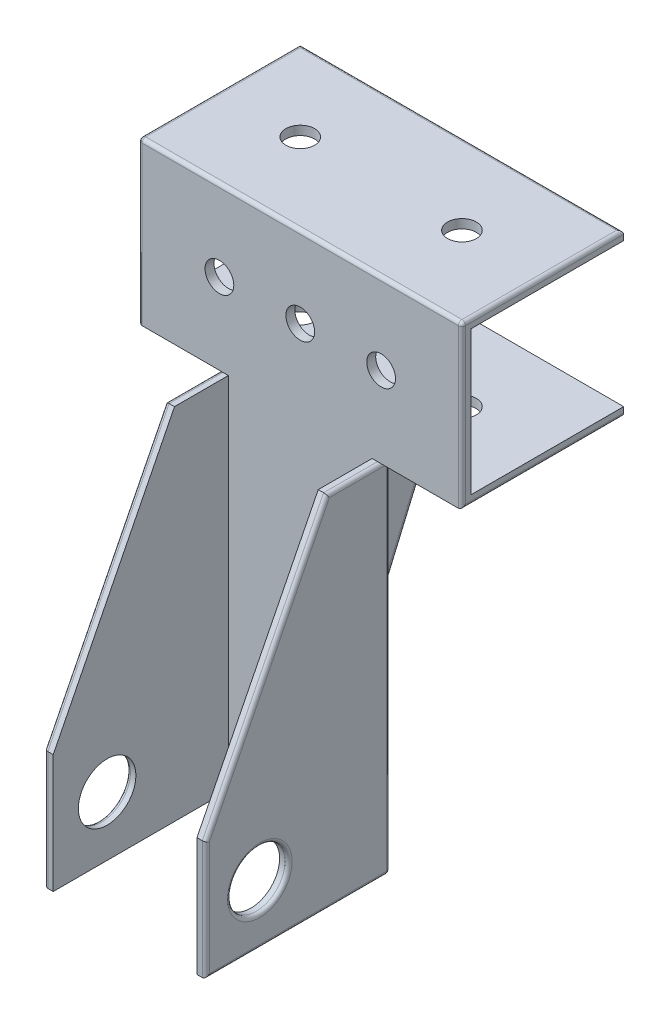
from build123d import *

# Parameters (mm, degrees)
DODANIE_WYCI_GNI_CIE1_DEPTH         = 45
DODANIE_WYCI_GNI_CIE1_DEPTH_BACK    = 45
SZKIC1_W                            = 45
SZKIC1_H                            = 45
WYTNIJ_WYCI_GNI_CIE1_DEPTH          = 96.45941546
WYTNIJ_WYCI_GNI_CIE1_DEPTH_BACK     = 96.45941546
SZKIC2_W                            = 42.5
SZKIC2_H                            = 40
DODANIE_WYCI_GNI_CIE2_DEPTH         = 70
DODANIE_WYCI_GNI_CIE2_DEPTH_BACK    = 2.5
SZKIC3_W                            = 45
SZKIC3_H                            = 100
SZKIC4_W                            = 40
SZKIC4_H                            = 70
WYTNIJ_WYCI_GNI_CIE2_DEPTH          = 144.461667354
SZKIC5_R                            = 8
WYTNIJ_WYCI_GNI_CIE4_DEPTH          = 90
ZAOKR_GLENIE2_R                     = 1
ZAOKR_GLENIE3_R                     = 1
SZKIC9_W                            = 4
SZKIC9_H                            = 45
OTWORY_USTALAJ_CE_8_0MM1_AT_2_COUNT = 2
OTWORY_USTALAJ_CE_8_0MM1_AT_2_PITCH = 22.5
OTWORY_USTALAJ_CE_8_0MM1_AT_3_COUNT = 2
OTWORY_USTALAJ_CE_8_0MM1_AT_3_PITCH = 45
SZKIC13_W                           = 4
SZKIC13_H                           = 145
OTWORY_USTALAJ_CE_8_0MM3_AT_2_COUNT = 2
OTWORY_USTALAJ_CE_8_0MM3_AT_2_PITCH = 45
DODANIE_WYCI_GNI_CIE3_DEPTH         = 1.5
DODANIE_WYCI_GNI_CIE3_DEPTH_BACK    = 1.5
ZAOKR_GLENIE4_R                     = 1.5


with BuildPart() as part:
    # Szkic1 → Dodanie-wyciągnięcie1 (new, two sides: drawn at the far end of the back side and taken through both)
    with BuildSketch(Plane(origin=(0, 0, 0), x_dir=(0, 0, -1), z_dir=(1, 0, 0)).offset(-DODANIE_WYCI_GNI_CIE1_DEPTH_BACK)):
        Rectangle(SZKIC1_W, SZKIC1_H)
    extrude(amount=DODANIE_WYCI_GNI_CIE1_DEPTH + DODANIE_WYCI_GNI_CIE1_DEPTH_BACK)

    # Szkic2 → Wytnij-wyciągnięcie1 (cut, two sides: drawn at the far end of the back side and taken through both)
    with BuildSketch(Plane.ZY.offset(45).offset(-WYTNIJ_WYCI_GNI_CIE1_DEPTH_BACK)):
        with Locations((-1.25, 0)):
            Rectangle(SZKIC2_W, SZKIC2_H)
    extrude(amount=WYTNIJ_WYCI_GNI_CIE1_DEPTH + WYTNIJ_WYCI_GNI_CIE1_DEPTH_BACK, mode=Mode.SUBTRACT)

    # Zaokrąglenie2
    zaokr_glenie2_edges = [part.edges().sort_by_distance(p)[0] for p in [
        (-45, 0, 22.5),
        (45, 22.5, 0),
        (45, 0, 22.5),
        (45, -22.5, 0),
        (-45, -22.5, 0),
        (0, 22.5, 22.5),
        (0, 22.5, -22.5),
        (-45, 22.5, 0),
    ]]
    fillet(zaokr_glenie2_edges, radius=ZAOKR_GLENIE2_R)

    # Szkic9 → Otwory ustalające Ø8.0mm1 (revolve, cut)
    with BuildSketch(Plane(origin=(-22.5, 0, 22.5), x_dir=(0, -1, 0), z_dir=(1, 0, 0))):
        with Locations((2, 22.5)):
            Rectangle(SZKIC9_W, SZKIC9_H)
    otwory_ustalaj_ce_8_0mm1 = revolve(axis=Axis((-22.5, 0, 28.85), (0, 0, -1)), mode=Mode.SUBTRACT)

    # Otwory ustalające Ø8.0mm1 at 2: Otwory ustalające Ø8.0mm1 ×2
    with Locations(*[(i * OTWORY_USTALAJ_CE_8_0MM1_AT_2_PITCH, 0, 0) for i in range(1, OTWORY_USTALAJ_CE_8_0MM1_AT_2_COUNT)]):
        add(otwory_ustalaj_ce_8_0mm1, mode=Mode.SUBTRACT)

    # Otwory ustalające Ø8.0mm1 at 3: Otwory ustalające Ø8.0mm1 ×2
    with Locations(*[(i * OTWORY_USTALAJ_CE_8_0MM1_AT_3_PITCH, 0, 0) for i in range(1, OTWORY_USTALAJ_CE_8_0MM1_AT_3_COUNT)]):
        add(otwory_ustalaj_ce_8_0mm1, mode=Mode.SUBTRACT)

    # Szkic13 → Otwory ustalające Ø8.0mm3 (revolve, cut)
    with BuildSketch(Plane(origin=(22.5, 22.5, 0), x_dir=(0, 0, 1), z_dir=(1, 0, 0))):
        with Locations((2, 72.5)):
            Rectangle(SZKIC13_W, SZKIC13_H)
    otwory_ustalaj_ce_8_0mm3 = revolve(axis=Axis((22.5, 28.85, 0), (0, -1, 0)), mode=Mode.SUBTRACT)

    # Otwory ustalające Ø8.0mm3 at 2: Otwory ustalające Ø8.0mm3 ×2
    with Locations(*[(-i * OTWORY_USTALAJ_CE_8_0MM3_AT_2_PITCH, 0, 0) for i in range(1, OTWORY_USTALAJ_CE_8_0MM3_AT_2_COUNT)]):
        add(otwory_ustalaj_ce_8_0mm3, mode=Mode.SUBTRACT)



with BuildPart() as body_2:
    # Szkic3 → Dodanie-wyciągnięcie2 (new, two sides: drawn at the far end of the back side and taken through both)
    with BuildSketch(Plane.XY.offset(22.5).offset(-DODANIE_WYCI_GNI_CIE2_DEPTH_BACK)):
        with Locations((0, -72.5)):
            Rectangle(SZKIC3_W, SZKIC3_H)
    extrude(amount=DODANIE_WYCI_GNI_CIE2_DEPTH + DODANIE_WYCI_GNI_CIE2_DEPTH_BACK)

    # Szkic4 → Wytnij-wyciągnięcie2 (cut, through all)
    with BuildSketch(Plane(origin=(0, -22.5, 0), x_dir=(1, 0, 0), z_dir=(0, 1, 0))):
        with Locations((0, -57.5)):
            Rectangle(SZKIC4_W, SZKIC4_H)
    extrude(amount=-WYTNIJ_WYCI_GNI_CIE2_DEPTH, mode=Mode.SUBTRACT)

    # Szkic5 → Wytnij-wyciągnięcie4 (cut)
    with BuildSketch(Plane.ZY.offset(22.5)):
        Polygon((71.25, -89.5), (71.25, -122.5), (92.5, -122.5), (92.5, -22.5), (37.5, -22.5), align=None)
        with Locations(Location((56.25, -106, 0), (0, 0, 270))):
            Circle(SZKIC5_R)
    extrude(amount=-WYTNIJ_WYCI_GNI_CIE4_DEPTH, mode=Mode.SUBTRACT)

    # Zaokrąglenie3
    zaokr_glenie3_edges = [body_2.edges().sort_by_distance(p)[0] for p in [
        (22.5, -72.5, 20),
        (22.5, -98, 56.25),
        (-22.5, -98, 56.25),
        (-22.5, -72.5, 20),
        (-22.5, -56, 54.375),
        (22.5, -56, 54.375),
        (-22.5, -106, 71.25),
        (22.5, -106, 71.25),
        (-22.5, -22.5, 28.75),
        (22.5, -22.5, 28.75),
        (22.5, -122.5, 45.625),
        (-22.5, -122.5, 45.625),
        (0, -122.5, 20),
    ]]
    fillet(zaokr_glenie3_edges, radius=ZAOKR_GLENIE3_R)


with BuildPart() as part_1:
    add(part.part)

    add(body_2.part)  # Dodanie-wyciągnięcie3 merges body 2
    # Szkic14 → Dodanie-wyciągnięcie3 (add, two sides: drawn at the far end of the back side and taken through both)
    with BuildSketch(Plane.ZY.offset(-DODANIE_WYCI_GNI_CIE3_DEPTH_BACK)):
        Polygon((20, -121.5), (-22.5, -22.5), (20, -22.5), align=None)
    extrude(amount=DODANIE_WYCI_GNI_CIE3_DEPTH + DODANIE_WYCI_GNI_CIE3_DEPTH_BACK)

    # Zaokrąglenie4
    zaokr_glenie4_edges = [part_1.edges().sort_by_distance(p)[0] for p in [
        (1.5, -72, -1.25),
        (-1.5, -72, -1.25),
    ]]
    fillet(zaokr_glenie4_edges, radius=ZAOKR_GLENIE4_R - 0.0001)  # a hair under: the kernel refuses the full size


solid = part_1.part
